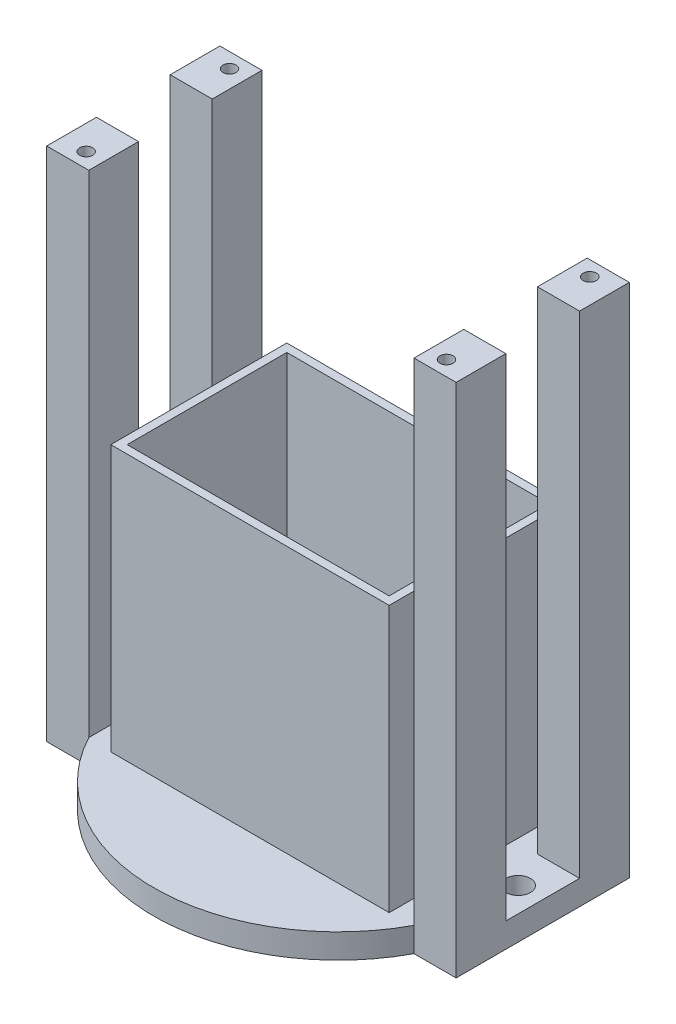
from build123d import *

# Parameters (mm, degrees)
BODY_DEPTH                = 6
SKETCH2_W                 = 10.280011329
SKETCH2_H                 = 42.3
WINGS_DEPTH               = 120
SKETCH3_R                 = 1.6
MOUNTING_BORE_DEPTH       = 143.832069228
CUT_EXCESS_MATERIAL_DEPTH = 168.03592428
CUT_HARNESS_MOUNT_REACH   = 144.832
SKETCH6_R                 = 3
SKETCH7_W                 = 68
SKETCH7_H                 = 43
SKETCH7_W_2               = 64
SKETCH7_H_2               = 39
BOSS_EXTRUDE3_DEPTH       = 65


with BuildPart() as part:
    # Sketch1 → body (new body)
    with BuildSketch(Plane(origin=(0, 0, 0), x_dir=(1, 0, 0), z_dir=(0, 1, 0))):
        with BuildLine():
            ThreePointArc((-39.719988671, -21.15), (0, -45), (39.719988671, -21.15))
            Line((39.719988671, -21.15), (50, -21.15))
            Line((50, -21.15), (50, 21.15))
            Line((50, 21.15), (39.719988671, 21.15))
            ThreePointArc((39.719988671, 21.15), (0, 45), (-39.719988671, 21.15))
            Line((-39.719988671, 21.15), (-50, 21.15))
            Line((-50, 21.15), (-50, -21.15))
            Line((-50, -21.15), (-39.719988671, -21.15))
        make_face()
    extrude(amount=BODY_DEPTH)

    # Sketch2 → wings (add)
    with BuildSketch(Plane(origin=(0, 6, 0), x_dir=(1, 0, 0), z_dir=(0, 1, 0))):
        with Locations((-44.859994336, 0)):
            Rectangle(SKETCH2_W, SKETCH2_H)
        with Locations((44.859994336, 0)):
            Rectangle(SKETCH2_W, SKETCH2_H)
    extrude(amount=WINGS_DEPTH)

    # Sketch3 → mounting-bore (cut, through all)
    with BuildSketch(Plane(origin=(0, 126, 0), x_dir=(1, 0, 0), z_dir=(0, 1, 0))):
        with Locations((44, -17.5)):
            Circle(SKETCH3_R)
        with Locations((-44, -17.5)):
            Circle(SKETCH3_R)
        with Locations((-44, 17.5)):
            Circle(SKETCH3_R)
        with Locations((44, 17.5)):
            Circle(SKETCH3_R)
    extrude(amount=-MOUNTING_BORE_DEPTH, mode=Mode.SUBTRACT)

    # Sketch5 → cut-excess-material (cut, through all)
    with BuildSketch(Plane(origin=(50, 0, 0), x_dir=(0, 0, -1), z_dir=(1, 0, 0))):
        Polygon((0, 6), (9, 6), (9, 126), (-9, 126), (-9, 6), align=None)
    extrude(amount=-CUT_EXCESS_MATERIAL_DEPTH, mode=Mode.SUBTRACT)

    # Sketch6 → cut-harness-mount (cut, up to next)
    with BuildSketch(Plane.XZ, mode=Mode.PRIVATE) as cut_harness_mount_sk1:
        with Locations((44, 0)):
            Circle(SKETCH6_R)
    cut_harness_mount_tool1 = extrude(cut_harness_mount_sk1.sketch, amount=-CUT_HARNESS_MOUNT_REACH, mode=Mode.PRIVATE) & part.part
    # Sketch6 → cut-harness-mount (cut, up to next)
    with BuildSketch(Plane.XZ, mode=Mode.PRIVATE) as cut_harness_mount_sk2:
        with Locations((-44, 0)):
            Circle(SKETCH6_R)
    cut_harness_mount_tool2 = extrude(cut_harness_mount_sk2.sketch, amount=-CUT_HARNESS_MOUNT_REACH, mode=Mode.PRIVATE) & part.part
    add(cut_harness_mount_tool1.solids().sort_by_distance((44, 0, 0))[0], mode=Mode.SUBTRACT)
    add(cut_harness_mount_tool2.solids().sort_by_distance((-44, 0, 0))[0], mode=Mode.SUBTRACT)

    # Sketch7 → Boss-Extrude3 (add)
    with BuildSketch(Plane(origin=(0, 6, 0), x_dir=(1, 0, 0), z_dir=(0, 1, 0))):
        Rectangle(SKETCH7_W, SKETCH7_H)
        Rectangle(SKETCH7_W_2, SKETCH7_H_2, mode=Mode.SUBTRACT)
    extrude(amount=BOSS_EXTRUDE3_DEPTH)


solid = part.part
